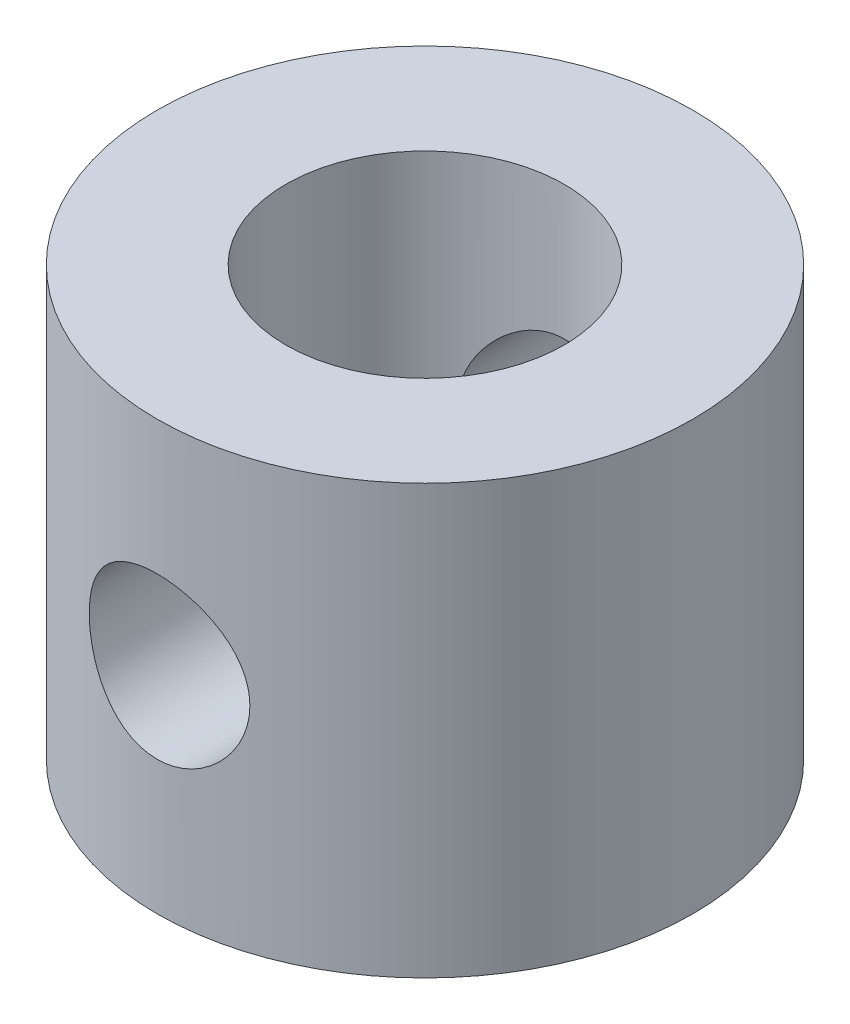
from build123d import *

# Parameters (mm, degrees)
SKETCH1_R           = 5
BOSS_EXTRUDE1_DEPTH = 8
SKETCH2_R           = 2.6
CUT_EXTRUDE1_DEPTH  = 20
SKETCH3_R           = 1.5
CUT_EXTRUDE2_DEPTH  = 20


with BuildPart() as part:
    # Sketch1 → Boss-Extrude1 (new body)
    with BuildSketch(Plane(origin=(0, 0, 0), x_dir=(1, 0, 0), z_dir=(0, 1, 0))):
        Circle(SKETCH1_R)
    extrude(amount=BOSS_EXTRUDE1_DEPTH)

    # Sketch2 → Cut-Extrude1 (cut, symmetric)
    with BuildSketch(Plane(origin=(0, 0, 0), x_dir=(1, 0, 0), z_dir=(0, 1, 0))):
        Circle(SKETCH2_R)
    extrude(amount=CUT_EXTRUDE1_DEPTH, both=True, mode=Mode.SUBTRACT)

    # Sketch3 → Cut-Extrude2 (cut, symmetric)
    with BuildSketch(Plane.XY):
        with Locations((0, 4)):
            Circle(SKETCH3_R)
    extrude(amount=CUT_EXTRUDE2_DEPTH, both=True, mode=Mode.SUBTRACT)


solid = part.part
